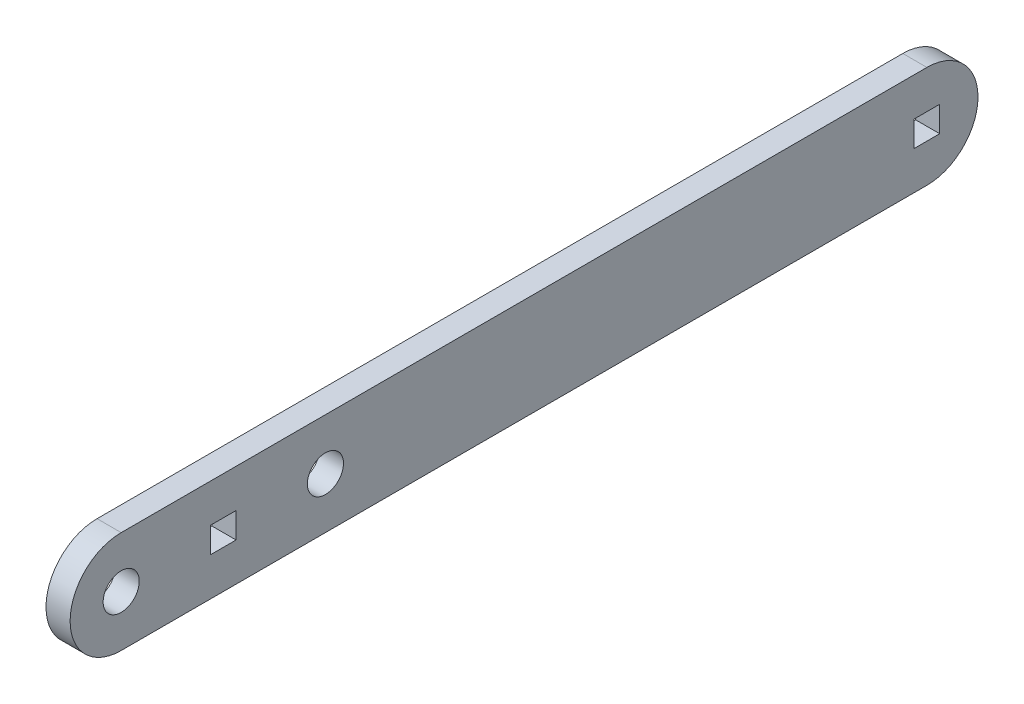
from build123d import *

# Parameters (mm, degrees)
SKETCH1_R           = 2.24506403
SKETCH1_W           = 3.175
SKETCH1_H           = 3.175
BOSS_EXTRUDE1_DEPTH = 3


with BuildPart() as part:
    # Sketch1 → Boss-Extrude1 (new body)
    with BuildSketch(Plane(origin=(0, 0, 0), x_dir=(0, 0, -1), z_dir=(1, 0, 0))):
        with BuildLine():
            Line((-100.203, 6.35), (0, 6.35))
            ThreePointArc((0, 6.35), (6.35, 0), (0, -6.35))
            Line((0, -6.35), (-100.203, -6.35))
            ThreePointArc((-100.203, -6.35), (-106.553, 0), (-100.203, 6.35))
        make_face()
        with Locations((-74.803, 0)):
            Circle(SKETCH1_R, mode=Mode.SUBTRACT)
        with Locations((-100.203, 0)):
            Circle(SKETCH1_R, mode=Mode.SUBTRACT)
        with Locations((-87.503, 0)):
            Rectangle(SKETCH1_W, SKETCH1_H, mode=Mode.SUBTRACT)
        Rectangle(SKETCH1_W, SKETCH1_H, mode=Mode.SUBTRACT)
    extrude(amount=BOSS_EXTRUDE1_DEPTH)


solid = part.part
